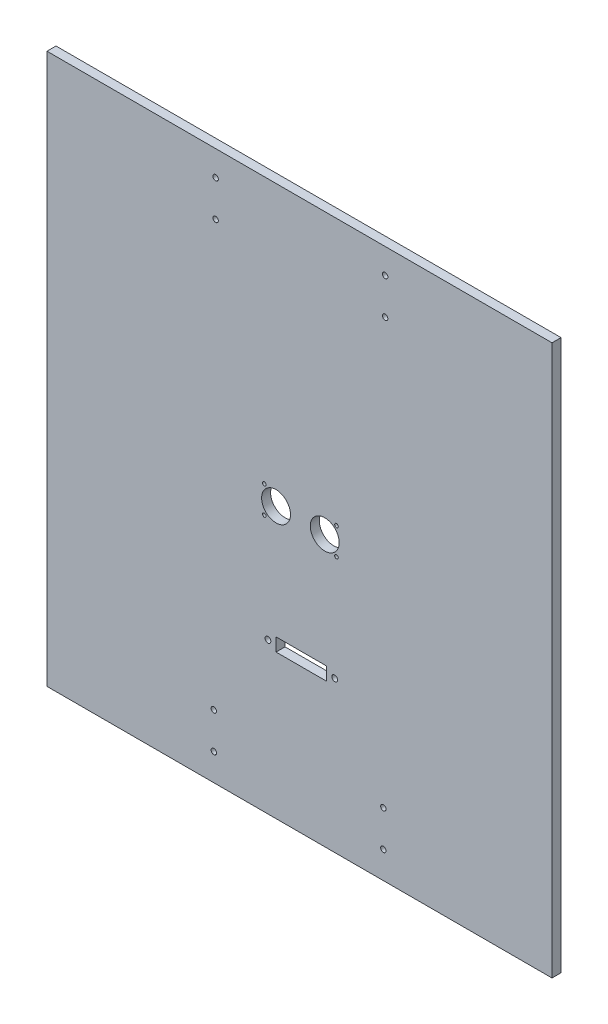
from build123d import *

# Parameters (mm, degrees)
ESQUISSE1_W             = 280
ESQUISSE1_H             = 305
BOSS_EXTRU_1_DEPTH      = 5
ESQUISSE2_R             = 1.5
ENL_V_MAT_EXTRU_1_DEPTH = 415.065212255
ESQUISSE3_R             = 1.5
ENL_V_MAT_EXTRU_2_DEPTH = 415.065212255
ESQUISSE4_R             = 1.6
ESQUISSE4_W             = 28
ESQUISSE4_H             = 7.3
ENL_V_MAT_EXTRU_3_DEPTH = 415.065212255
ESQUISSE5_R             = 8
ESQUISSE5_R_2           = 1
ENL_V_MAT_EXTRU_4_DEPTH = 415.065212255


with BuildPart() as part:
    # Esquisse1 → Boss.-Extru.1 (new body)
    with BuildSketch(Plane.XY):
        with Locations((140, 152.5)):
            Rectangle(ESQUISSE1_W, ESQUISSE1_H)
    extrude(amount=BOSS_EXTRU_1_DEPTH)

    # Esquisse2 → Enlèv. mat.-Extru.1 (cut, through all)
    with BuildSketch(Plane.XY.offset(5)):
        with Locations((92.5, 35)):
            Circle(ESQUISSE2_R)
        with Locations((92.5, 15)):
            Circle(ESQUISSE2_R)
        with Locations((186.5, 35)):
            Circle(ESQUISSE2_R)
        with Locations((186.5, 15)):
            Circle(ESQUISSE2_R)
    extrude(amount=-ENL_V_MAT_EXTRU_1_DEPTH, mode=Mode.SUBTRACT)

    # Esquisse3 → Enlèv. mat.-Extru.2 (cut, through all)
    with BuildSketch(Plane.XY.offset(5)):
        with Locations((187.5, 271.037613724)):
            Circle(ESQUISSE3_R)
        with Locations((187.5, 291.037613724)):
            Circle(ESQUISSE3_R)
        with Locations((93.5, 271.037613724)):
            Circle(ESQUISSE3_R)
        with Locations((93.5, 291.037613724)):
            Circle(ESQUISSE3_R)
    extrude(amount=-ENL_V_MAT_EXTRU_2_DEPTH, mode=Mode.SUBTRACT)

    # Esquisse4 → Enlèv. mat.-Extru.3 (cut, through all)
    with BuildSketch(Plane(origin=(0, 0, 0), x_dir=(-1, 0, 0), z_dir=(0, 0, -1))):
        with Locations((-159.5, 83.65)):
            Circle(ESQUISSE4_R)
        with Locations((-122.5, 83.65)):
            Circle(ESQUISSE4_R)
        with Locations((-141, 83.65)):
            Rectangle(ESQUISSE4_W, ESQUISSE4_H)
    extrude(amount=-ENL_V_MAT_EXTRU_3_DEPTH, mode=Mode.SUBTRACT)

    # Esquisse5 → Enlèv. mat.-Extru.4 (cut, through all)
    with BuildSketch(Plane(origin=(0, 0, 0), x_dir=(-1, 0, 0), z_dir=(0, 0, -1))):
        with Locations((-154, 150)):
            Circle(ESQUISSE5_R)
        with Locations((-127, 150)):
            Circle(ESQUISSE5_R)
        with Locations((-160.502638889, 157.491467645)):
            Circle(ESQUISSE5_R_2)
        with Locations((-120.502645848, 157.515062528)):
            Circle(ESQUISSE5_R_2)
        with Locations((-120.498818515, 142.502017666)):
            Circle(ESQUISSE5_R_2)
        with Locations((-160.498818515, 142.491467645)):
            Circle(ESQUISSE5_R_2)
    extrude(amount=-ENL_V_MAT_EXTRU_4_DEPTH, mode=Mode.SUBTRACT)


solid = part.part
